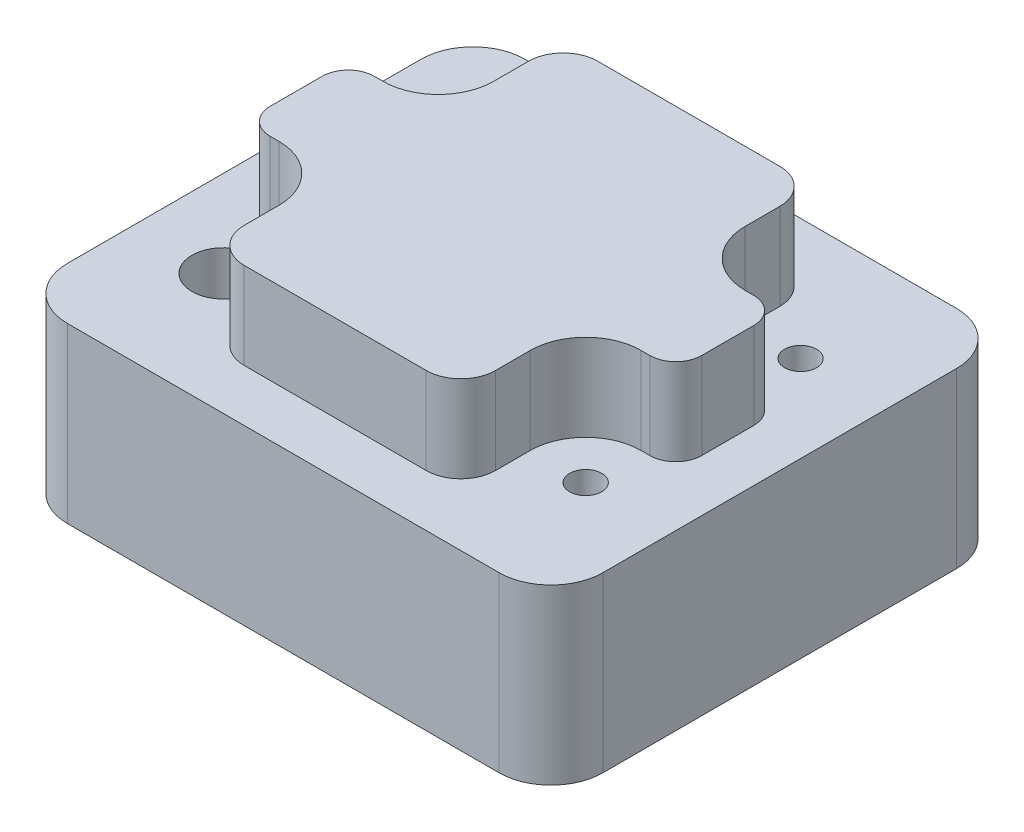
from build123d import *

# Parameters (mm, degrees)
BOSS_EXTRUDE1_DEPTH = 5
SKETCH2_W           = 30.9
SKETCH2_H           = 26.4
BOSS_EXTRUDE2_DEPTH = 10
SKETCH3_R           = 0.925
SKETCH3_R_2         = 1.815
CUT_EXTRUDE1_DEPTH  = 26.257523632
FILLET1_R           = 3


with BuildPart() as part:
    # Sketch1 → Boss-Extrude1 (new body)
    with BuildSketch(Plane(origin=(0, 0, 0), x_dir=(1, 0, 0), z_dir=(0, 1, 0))):
        with BuildLine():
            Line((5.25, 10.2), (-5.25, 10.2))
            ThreePointArc((-5.25, 10.2), (-6.664213562, 9.614213562), (-7.25, 8.2))
            Line((-7.25, 8.2), (-7.25, 6.2))
            ThreePointArc((-7.25, 6.2), (-8.1872583, 3.9372583), (-10.45, 3))
            Line((-10.45, 3), (-10.95, 3))
            ThreePointArc((-10.95, 3), (-12.010660172, 2.560660172), (-12.45, 1.5))
            Line((-12.45, 1.5), (-12.45, -1.5))
            ThreePointArc((-12.45, -1.5), (-12.010660172, -2.560660172), (-10.95, -3))
            Line((-10.95, -3), (-10.45, -3))
            ThreePointArc((-10.45, -3), (-8.1872583, -3.9372583), (-7.25, -6.2))
            Line((-7.25, -6.2), (-7.25, -8.2))
            ThreePointArc((-7.25, -8.2), (-6.664213562, -9.614213562), (-5.25, -10.2))
            Line((-5.25, -10.2), (5.25, -10.2))
            ThreePointArc((5.25, -10.2), (6.664213562, -9.614213562), (7.25, -8.2))
            Line((7.25, -8.2), (7.25, -6.2))
            ThreePointArc((7.25, -6.2), (8.1872583, -3.9372583), (10.45, -3))
            Line((10.45, -3), (10.95, -3))
            ThreePointArc((10.95, -3), (12.010660172, -2.560660172), (12.45, -1.5))
            Line((12.45, -1.5), (12.45, 1.5))
            ThreePointArc((12.45, 1.5), (12.010660172, 2.560660172), (10.95, 3))
            Line((10.95, 3), (10.45, 3))
            ThreePointArc((10.45, 3), (8.1872583, 3.9372583), (7.25, 6.2))
            Line((7.25, 6.2), (7.25, 8.2))
            ThreePointArc((7.25, 8.2), (6.664213562, 9.614213562), (5.25, 10.2))
        make_face()
    extrude(amount=BOSS_EXTRUDE1_DEPTH)

    # Sketch2 → Boss-Extrude2 (add)
    with BuildSketch(Plane.XZ):
        Rectangle(SKETCH2_W, SKETCH2_H)
    extrude(amount=BOSS_EXTRUDE2_DEPTH)

    # Sketch3 → Cut-Extrude1 (cut, through all)
    with BuildSketch(Plane.XZ.offset(10)):
        with Locations((10.45, 6.2)):
            Circle(SKETCH3_R)
        with Locations((10.45, -6.2)):
            Circle(SKETCH3_R)
        with Locations((-10.45, -6.2)):
            Circle(SKETCH3_R_2)
        with Locations((-10.45, 6.2)):
            Circle(SKETCH3_R_2)
    extrude(amount=-CUT_EXTRUDE1_DEPTH, mode=Mode.SUBTRACT)

    # Fillet1
    fillet1_edges = [part.edges().sort_by_distance(p)[0] for p in [
        (15.45, -5, -13.2),
        (15.45, -5, 13.2),
        (-15.45, -5, -13.2),
        (-15.45, -5, 13.2),
    ]]
    fillet(fillet1_edges, radius=FILLET1_R)


solid = part.part
